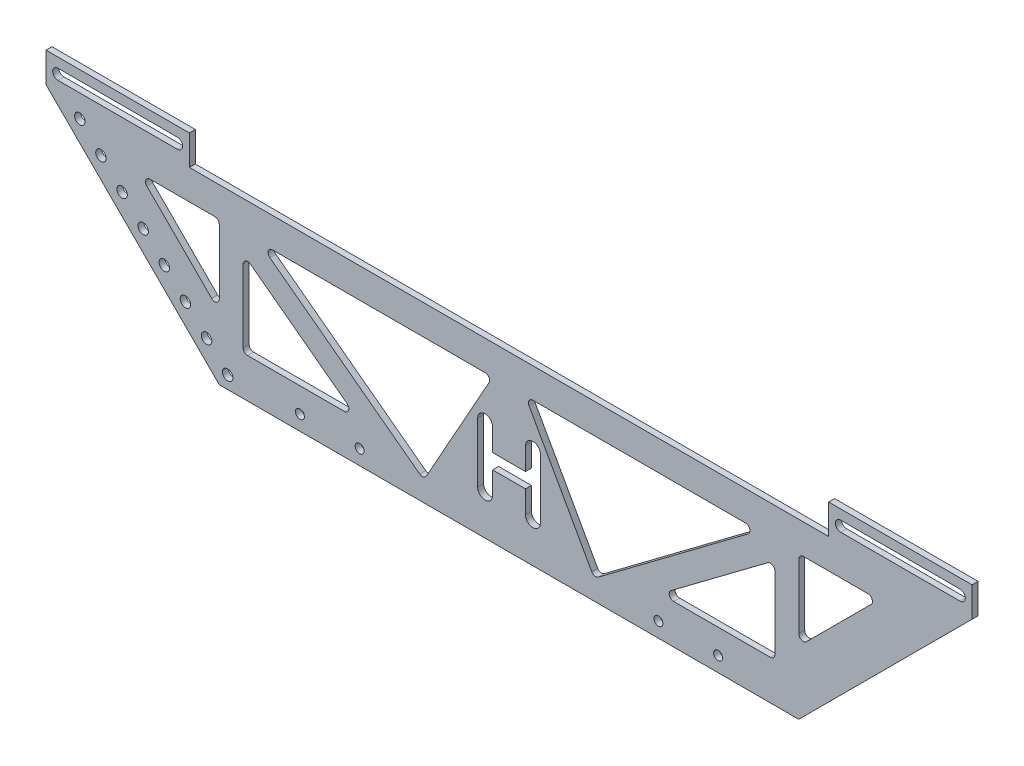
from build123d import *

# Parameters (mm, degrees)
SKETCH_1_R               = 1.5
EXTRUDE_1_DEPTH          = 2
SKETCH_3_W               = 310
SKETCH_3_H               = 20
CUT_EXTRUDE_2_DEPTH      = 166.508307949
CUT_EXTRUDE_3_DEPTH      = 166.508307949
CUT_EXTRUDE_3_DEPTH_BACK = 166.508307949
CUT_EXTRUDE_4_DEPTH      = 166.508307949
SKETCH_7_R               = 1.75
CUT_EXTRUDE_6_DEPTH      = 166.508307949


with BuildPart() as part:
    # 草图1 → 凸台-拉伸1 (new body)
    with BuildSketch(Plane.XY):
        Polygon((-107, 30), (-107, 0), (107, 0), (107, 30), (155, 30), (155, 0), (97, -58), (-97, -58), (-155, 0), (-155, 30), align=None)
        with Locations((-151, 25)):
            Circle(SKETCH_1_R, mode=Mode.SUBTRACT)
        with Locations((-111, 25)):
            Circle(SKETCH_1_R, mode=Mode.SUBTRACT)
        with Locations((-111, 5)):
            Circle(SKETCH_1_R, mode=Mode.SUBTRACT)
        with Locations((-151, 5)):
            Circle(SKETCH_1_R, mode=Mode.SUBTRACT)
        with Locations((151, 5)):
            Circle(SKETCH_1_R, mode=Mode.SUBTRACT)
        with Locations((111, 5)):
            Circle(SKETCH_1_R, mode=Mode.SUBTRACT)
        with Locations((111, 25)):
            Circle(SKETCH_1_R, mode=Mode.SUBTRACT)
        with Locations((151, 25)):
            Circle(SKETCH_1_R, mode=Mode.SUBTRACT)
        with Locations((-70, -53)):
            Circle(SKETCH_1_R, mode=Mode.SUBTRACT)
        with Locations((-50, -53)):
            Circle(SKETCH_1_R, mode=Mode.SUBTRACT)
        with Locations((50, -53)):
            Circle(SKETCH_1_R, mode=Mode.SUBTRACT)
        with Locations((70, -53)):
            Circle(SKETCH_1_R, mode=Mode.SUBTRACT)
    extrude(amount=EXTRUDE_1_DEPTH)

    # 草图3 → 切除-拉伸2 (cut, through all)
    with BuildSketch(Plane.XY.offset(2)):
        with Locations((0, 20)):
            Rectangle(SKETCH_3_W, SKETCH_3_H)
    extrude(amount=-CUT_EXTRUDE_2_DEPTH, mode=Mode.SUBTRACT)

    # 草图4 → 切除-拉伸3 (cut, two sides: drawn at the far end of the back side and taken through both)
    with BuildSketch(Plane.XY.offset(2).offset(-CUT_EXTRUDE_3_DEPTH_BACK)):
        with BuildLine():
            ThreePointArc((-120.165476221, -10), (-121.55129552, -10.925974851), (-121.226136393, -12.560660172))
            Line((-121.226136393, -12.560660172), (-99.560660172, -34.226136393))
            ThreePointArc((-99.560660172, -34.226136393), (-97.925974851, -34.55129552), (-97, -33.165476221))
            Line((-97, -33.165476221), (-97, -11.5))
            ThreePointArc((-97, -11.5), (-97.439339828, -10.439339828), (-98.5, -10))
            Line((-98.5, -10), (-120.165476221, -10))
        make_face()
        with BuildLine():
            ThreePointArc((-86.6, -17.8), (-88.170820393, -17.658359214), (-89, -19))
            Line((-89, -19), (-89, -43.286796564))
            ThreePointArc((-89, -43.286796564), (-88.560660172, -44.347456736), (-87.5, -44.786796564))
            Line((-87.5, -44.786796564), (-55.117604581, -44.786796564))
            ThreePointArc((-55.117604581, -44.786796564), (-53.694579634, -43.761138213), (-54.217604581, -42.086796564))
            Line((-54.217604581, -42.086796564), (-86.6, -17.8))
        make_face()
        with BuildLine():
            Line((-8, -10), (-79.166666667, -10))
            ThreePointArc((-79.166666667, -10), (-80.589691614, -11.025658351), (-80.066666667, -12.7))
            Line((-80.066666667, -12.7), (-29.9, -50.325))
            ThreePointArc((-29.9, -50.325), (-28.688612769, -50.592323411), (-27.690203447, -49.856049239))
            Line((-27.690203447, -49.856049239), (-6.690203447, -12.231049239))
            ThreePointArc((-6.690203447, -12.231049239), (-6.706444076, -10.74058373), (-8, -10))
        make_face()
        with BuildLine():
            ThreePointArc((27.690203447, -49.856049239), (28.688612769, -50.592323411), (29.9, -50.325))
            Line((29.9, -50.325), (80.066666667, -12.7))
            ThreePointArc((80.066666667, -12.7), (80.589691614, -11.025658351), (79.166666667, -10))
            Line((79.166666667, -10), (8, -10))
            ThreePointArc((8, -10), (6.706444076, -10.74058373), (6.690203447, -12.231049239))
            Line((6.690203447, -12.231049239), (27.690203447, -49.856049239))
        make_face()
        with BuildLine():
            Line((86.6, -17.8), (54.217604581, -42.086796564))
            ThreePointArc((54.217604581, -42.086796564), (53.694579634, -43.761138213), (55.117604581, -44.786796564))
            Line((55.117604581, -44.786796564), (87.5, -44.786796564))
            ThreePointArc((87.5, -44.786796564), (88.560660172, -44.347456736), (89, -43.286796564))
            Line((89, -43.286796564), (89, -19))
            ThreePointArc((89, -19), (88.170820393, -17.658359214), (86.6, -17.8))
        make_face()
        with BuildLine():
            Line((120.165476221, -10), (98.5, -10))
            ThreePointArc((98.5, -10), (97.439339828, -10.439339828), (97, -11.5))
            Line((97, -11.5), (97, -33.165476221))
            ThreePointArc((97, -33.165476221), (97.925974851, -34.55129552), (99.560660172, -34.226136393))
            Line((99.560660172, -34.226136393), (121.226136393, -12.560660172))
            ThreePointArc((121.226136393, -12.560660172), (121.55129552, -10.925974851), (120.165476221, -10))
        make_face()
        with BuildLine():
            Line((5.5, -31.928047473), (-5.5, -31.928047473))
            Line((-5.5, -31.928047473), (-5.5, -24.428047473))
            ThreePointArc((-5.5, -24.428047473), (-8, -21.928047473), (-10.5, -24.428047473))
            Line((-10.5, -24.428047473), (-10.5, -44.428047473))
            ThreePointArc((-10.5, -44.428047473), (-8, -46.928047473), (-5.5, -44.428047473))
            Line((-5.5, -44.428047473), (-5.5, -36.928047473))
            Line((-5.5, -36.928047473), (5.5, -36.928047473))
            Line((5.5, -36.928047473), (5.5, -44.428047473))
            ThreePointArc((5.5, -44.428047473), (8, -46.928047473), (10.5, -44.428047473))
            Line((10.5, -44.428047473), (10.5, -24.428047473))
            ThreePointArc((10.5, -24.428047473), (8, -21.928047473), (5.5, -24.428047473))
            Line((5.5, -24.428047473), (5.5, -31.928047473))
        make_face()
    extrude(amount=CUT_EXTRUDE_3_DEPTH + CUT_EXTRUDE_3_DEPTH_BACK, mode=Mode.SUBTRACT)

    # 草图5 → 切除-拉伸4 (cut, through all)
    with BuildSketch(Plane.XY.offset(2)):
        with BuildLine():
            Line((-151, 6.75), (-111, 6.75))
            ThreePointArc((-111, 6.75), (-109.25, 5), (-111, 3.25))
            Line((-111, 3.25), (-151, 3.25))
            ThreePointArc((-151, 3.25), (-152.75, 5), (-151, 6.75))
        make_face()
        with BuildLine():
            Line((111, 6.75), (151, 6.75))
            ThreePointArc((151, 6.75), (152.75, 5), (151, 3.25))
            Line((151, 3.25), (111, 3.25))
            ThreePointArc((111, 3.25), (109.25, 5), (111, 6.75))
        make_face()
    extrude(amount=-CUT_EXTRUDE_4_DEPTH, mode=Mode.SUBTRACT)

    # 草图7 → 切除-拉伸6 (cut, through all)
    with BuildSketch(Plane.XY.offset(2)):
        with Locations((-143.67766953, -4.251262658)):
            Circle(SKETCH_7_R)
        with Locations((-94.180194847, -53.748737342)):
            Circle(SKETCH_7_R)
        with Locations((-101.251262658, -46.67766953)):
            Circle(SKETCH_7_R)
        with Locations((-108.32233047, -39.606601718)):
            Circle(SKETCH_7_R)
        with Locations((-115.393398282, -32.535533906)):
            Circle(SKETCH_7_R)
        with Locations((-122.464466094, -25.464466094)):
            Circle(SKETCH_7_R)
        with Locations((-129.535533906, -18.393398282)):
            Circle(SKETCH_7_R)
        with Locations((-136.606601718, -11.32233047)):
            Circle(SKETCH_7_R)
    extrude(amount=-CUT_EXTRUDE_6_DEPTH, mode=Mode.SUBTRACT)


solid = part.part
